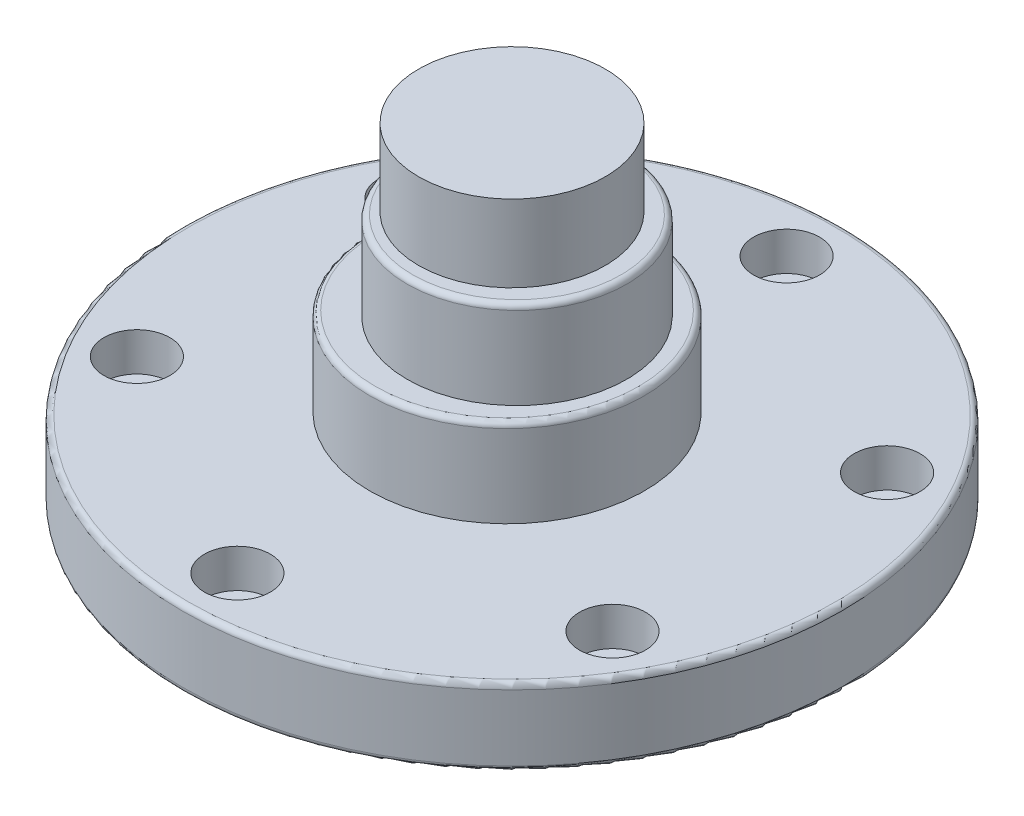
from build123d import *

# Parameters (mm, degrees)
SKETCH1_R           = 30
SKETCH1_R_2         = 1.65
BOSS_EXTRUDE1_DEPTH = 7
SKETCH2_R           = 12.5
BOSS_EXTRUDE2_DEPTH = 8
SKETCH3_R           = 10
BOSS_EXTRUDE3_DEPTH = 8
FILLET1_R           = 0.5
SKETCH4_R           = 3
CUT_EXTRUDE1_DEPTH  = 3.5
SKETCH5_R           = 8.5
BOSS_EXTRUDE4_DEPTH = 7


with BuildPart() as part:
    # Sketch1 → Boss-Extrude1 (new body)
    with BuildSketch(Plane(origin=(0, 0, 0), x_dir=(1, 0, 0), z_dir=(0, 1, 0))):
        Circle(SKETCH1_R)
        with Locations((0, 25)):
            Circle(SKETCH1_R_2, mode=Mode.SUBTRACT)
        with Locations((21.650635095, 12.5)):
            Circle(SKETCH1_R_2, mode=Mode.SUBTRACT)
        with Locations((21.650635095, -12.5)):
            Circle(SKETCH1_R_2, mode=Mode.SUBTRACT)
        with Locations((0, -25)):
            Circle(SKETCH1_R_2, mode=Mode.SUBTRACT)
        with Locations((-21.650635095, -12.5)):
            Circle(SKETCH1_R_2, mode=Mode.SUBTRACT)
        with Locations((-21.650635095, 12.5)):
            Circle(SKETCH1_R_2, mode=Mode.SUBTRACT)
    extrude(amount=BOSS_EXTRUDE1_DEPTH)

    # Sketch2 → Boss-Extrude2 (add)
    with BuildSketch(Plane(origin=(0, 7, 0), x_dir=(1, 0, 0), z_dir=(0, 1, 0))):
        with Locations((-0.45, 0)):
            Circle(SKETCH2_R)
    extrude(amount=BOSS_EXTRUDE2_DEPTH)

    # Sketch3 → Boss-Extrude3 (add)
    with BuildSketch(Plane(origin=(0, 15, 0), x_dir=(1, 0, 0), z_dir=(0, 1, 0))):
        with Locations((0.45, 0)):
            Circle(SKETCH3_R)
    extrude(amount=BOSS_EXTRUDE3_DEPTH)

    # Fillet1
    fillet1_edges = [part.edges().sort_by_distance(p)[0] for p in [
        (-9.55, 23, 0),
        (-12.95, 15, 0),
        (-30, 0, 0),
        (-30, 7, 0),
    ]]
    fillet(fillet1_edges, radius=FILLET1_R)

    # Sketch4 → Cut-Extrude1 (cut)
    with BuildSketch(Plane(origin=(0, 7, 0), x_dir=(1, 0, 0), z_dir=(0, 1, 0))):
        with Locations((0, 25)):
            Circle(SKETCH4_R)
        with Locations((21.650635095, 12.5)):
            Circle(SKETCH4_R)
        with Locations((21.650635095, -12.5)):
            Circle(SKETCH4_R)
        with Locations((0, -25)):
            Circle(SKETCH4_R)
        with Locations((-21.650635095, -12.5)):
            Circle(SKETCH4_R)
        with Locations((-21.650635095, 12.5)):
            Circle(SKETCH4_R)
    extrude(amount=-CUT_EXTRUDE1_DEPTH, mode=Mode.SUBTRACT)

    # Sketch5 → Boss-Extrude4 (add)
    with BuildSketch(Plane(origin=(0, 23, 0), x_dir=(1, 0, 0), z_dir=(0, 1, 0))):
        Circle(SKETCH5_R)
    extrude(amount=BOSS_EXTRUDE4_DEPTH)


solid = part.part
